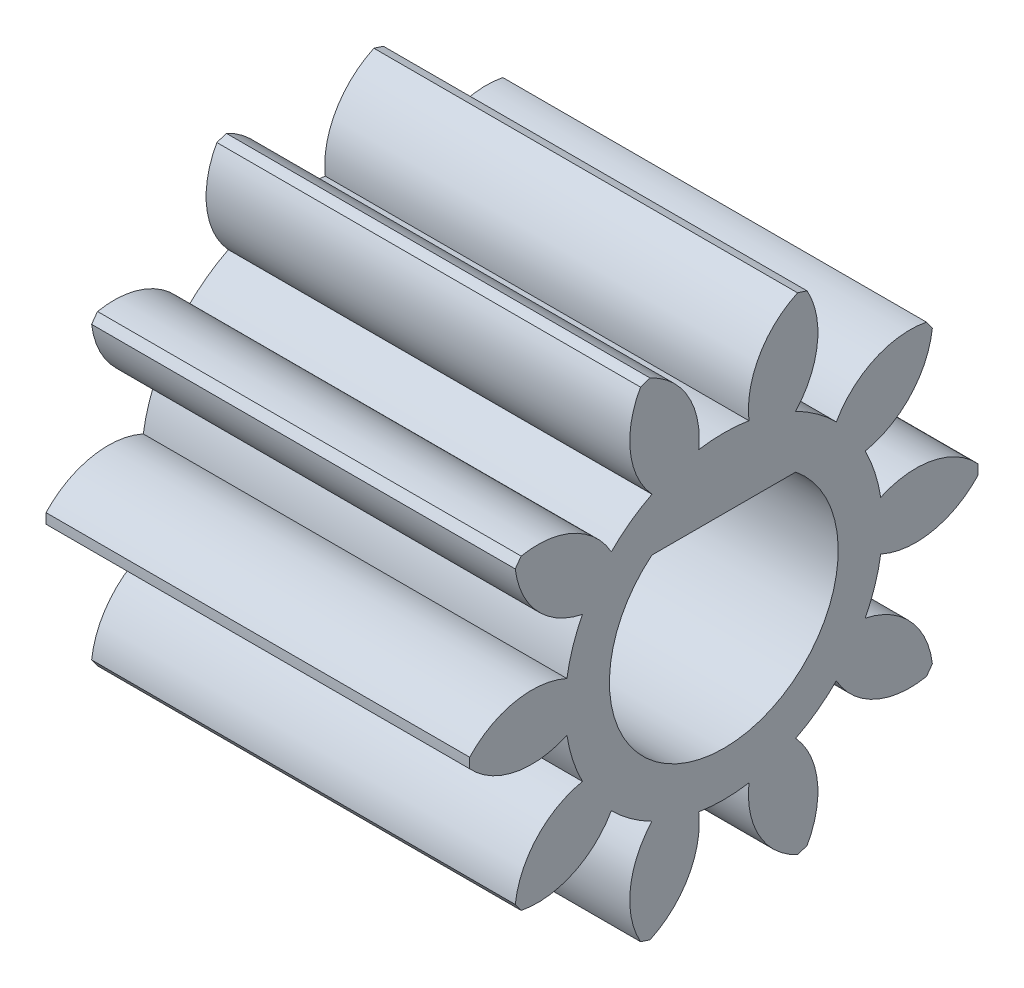
from build123d import *

# Parameters (mm, degrees)
SPUR_START             = -9.526796012
SPUR_GEAR_AM_OUTLINE_R = 2.5
SPUR_GEAR_AM_DEPTH     = 10
SKETCH1_R              = 2.7
CUT_EXTRUDE1_DEPTH     = 14.319939227
BOSS_EXTRUDE1_DEPTH    = 10


# Read off the part's stored shape, not the designer's step: spur gear_am
with BuildPart() as part:
    # spur gear_am outline → spur gear_am (new body)
    with BuildSketch(Plane.YZ.offset(SPUR_START)):
        with BuildLine():
            ThreePointArc((-0.156519062, -5.364277595), (-0.037626451, -5.365455666), (0.081266159, -5.364277595))
            ThreePointArc((0.081266159, -5.364277595), (0.682735226, -4.291319539), (0.542534544, -3.069293435))
            ThreePointArc((0.542534544, -3.069293435), (1.12087826, -2.930966545), (1.670074661, -2.702933442))
            ThreePointArc((1.670074661, -2.702933442), (2.274938849, -3.773981221), (3.392206468, -4.288487876))
            ThreePointArc((3.392206468, -4.288487876), (3.489085062, -4.219557632), (3.584578752, -4.14872123))
            ThreePointArc((3.584578752, -4.14872123), (3.440508527, -2.927145281), (2.608794871, -2.020913288))
            ThreePointArc((2.608794871, -2.020913288), (2.995378261, -1.569062577), (3.305652987, -1.061770376))
            ThreePointArc((3.305652987, -1.061770376), (4.424544483, -1.572735982), (5.630852398, -1.33226718))
            ThreePointArc((5.630852398, -1.33226718), (5.668712646, -1.219557632), (5.704332072, -1.106119996))
            ThreePointArc((5.704332072, -1.106119996), (4.869752484, -0.202526647), (3.664212201, 0.041761415))
            ThreePointArc((3.664212201, 0.041761415), (3.711373549, 0.634544334), (3.664212201, 1.227327254))
            ThreePointArc((3.664212201, 1.227327254), (4.869752484, 1.471615316), (5.704332072, 2.375208665))
            ThreePointArc((5.704332072, 2.375208665), (5.668712646, 2.488646301), (5.630852398, 2.601355849))
            ThreePointArc((5.630852398, 2.601355849), (4.424544483, 2.84182465), (3.305652987, 2.330859045))
            ThreePointArc((3.305652987, 2.330859045), (2.995378261, 2.838151246), (2.608794871, 3.290001957))
            ThreePointArc((2.608794871, 3.290001957), (3.440508527, 4.19623395), (3.584578752, 5.417809899))
            ThreePointArc((3.584578752, 5.417809899), (3.489085062, 5.488646301), (3.392206468, 5.557576545))
            ThreePointArc((3.392206468, 5.557576545), (2.274938849, 5.04306989), (1.670074661, 3.972022111))
            ThreePointArc((1.670074661, 3.972022111), (1.12087826, 4.200055214), (0.542534544, 4.338382103))
            ThreePointArc((0.542534544, 4.338382103), (0.682735226, 5.560408207), (0.081266159, 6.633366264))
            ThreePointArc((0.081266159, 6.633366264), (-0.037626451, 6.634544334), (-0.156519062, 6.633366264))
            ThreePointArc((-0.156519062, 6.633366264), (-0.757988129, 5.560408207), (-0.617787447, 4.338382103))
            ThreePointArc((-0.617787447, 4.338382103), (-1.196131163, 4.200055214), (-1.745327564, 3.972022111))
            ThreePointArc((-1.745327564, 3.972022111), (-2.350191752, 5.04306989), (-3.467459371, 5.557576545))
            ThreePointArc((-3.467459371, 5.557576545), (-3.564337965, 5.488646301), (-3.659831655, 5.417809899))
            ThreePointArc((-3.659831655, 5.417809899), (-3.51576143, 4.19623395), (-2.684047774, 3.290001957))
            ThreePointArc((-2.684047774, 3.290001957), (-3.070631163, 2.838151245), (-3.38090589, 2.330859045))
            ThreePointArc((-3.38090589, 2.330859045), (-4.499797386, 2.84182465), (-5.706105301, 2.601355849))
            ThreePointArc((-5.706105301, 2.601355849), (-5.743965549, 2.488646301), (-5.779584975, 2.375208665))
            ThreePointArc((-5.779584975, 2.375208665), (-4.945005387, 1.471615316), (-3.739465104, 1.227327254))
            ThreePointArc((-3.739465104, 1.227327254), (-3.786626451, 0.634544334), (-3.739465104, 0.041761415))
            ThreePointArc((-3.739465104, 0.041761415), (-4.945005387, -0.202526647), (-5.779584975, -1.106119996))
            ThreePointArc((-5.779584975, -1.106119996), (-5.743965549, -1.219557632), (-5.706105301, -1.33226718))
            ThreePointArc((-5.706105301, -1.33226718), (-4.499797386, -1.572735982), (-3.38090589, -1.061770376))
            ThreePointArc((-3.38090589, -1.061770376), (-3.070631163, -1.569062576), (-2.684047774, -2.020913288))
            ThreePointArc((-2.684047774, -2.020913288), (-3.51576143, -2.927145281), (-3.659831655, -4.14872123))
            ThreePointArc((-3.659831655, -4.14872123), (-3.564337965, -4.219557632), (-3.467459371, -4.288487876))
            ThreePointArc((-3.467459371, -4.288487876), (-2.350191752, -3.773981221), (-1.745327564, -2.702933442))
            ThreePointArc((-1.745327564, -2.702933442), (-1.196131163, -2.930966545), (-0.617787447, -3.069293435))
            ThreePointArc((-0.617787447, -3.069293435), (-0.757988129, -4.291319539), (-0.156519062, -5.364277595))
        make_face()
        with Locations((-0.037626451, 0.634544334)):
            Circle(SPUR_GEAR_AM_OUTLINE_R, mode=Mode.SUBTRACT)
    extrude(amount=SPUR_GEAR_AM_DEPTH)

    # Sketch1 → Cut-Extrude1 (cut, through all)
    with BuildSketch(Plane.ZY.offset(9.526796012)):
        with Locations((0.634544334, -0.037626451)):
            Circle(SKETCH1_R)
    extrude(amount=-CUT_EXTRUDE1_DEPTH, mode=Mode.SUBTRACT)

    # Sketch2 → Boss-Extrude1 (add, through all)
    with BuildSketch(Plane.ZY.offset(9.526796012)):
        with BuildLine():
            Line((2.331600609, 2.062373549), (-1.06251194, 2.062373549))
            ThreePointArc((-1.06251194, 2.062373549), (0.634544334, 2.662373549), (2.331600609, 2.062373549))
        make_face()
    extrude(amount=-BOSS_EXTRUDE1_DEPTH)


solid = part.part
